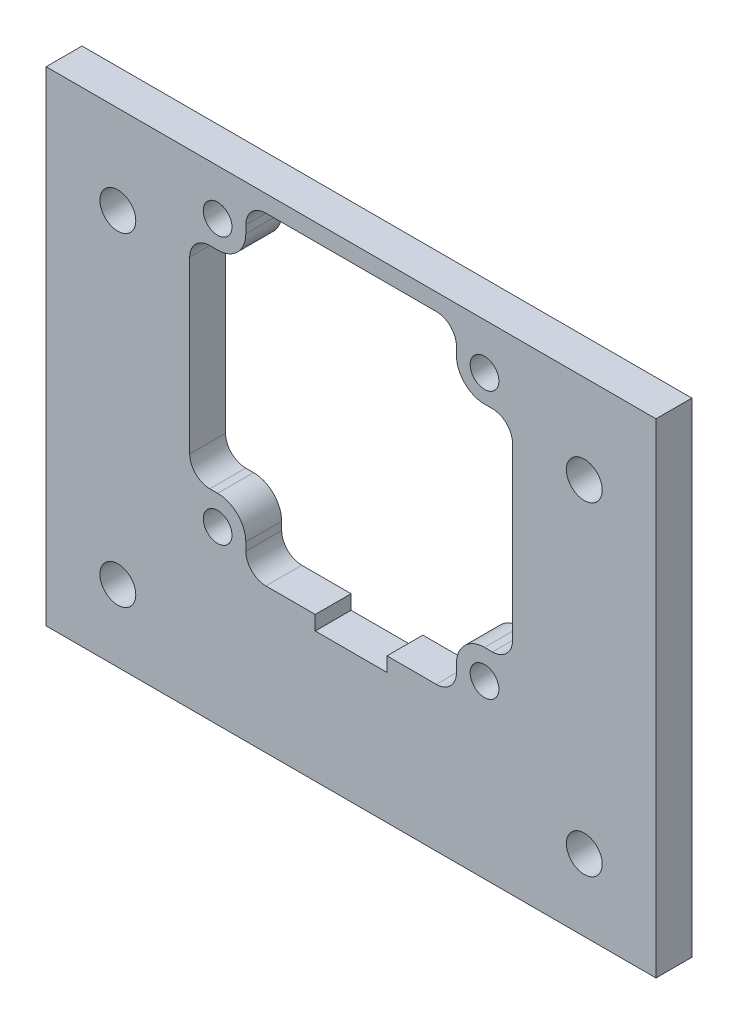
from build123d import *

# Parameters (mm, degrees)
SKETCH1_W           = 107.95
SKETCH1_H           = 85.725
BOSS_EXTRUDE1_DEPTH = 6.35
SKETCH11_R          = 2.54
CUT_EXTRUDE2_DEPTH  = 7.62
CUT_EXTRUDE3_DEPTH  = 7.62
SKETCH13_R          = 3.175
CUT_EXTRUDE4_DEPTH  = 7.62


with BuildPart() as part:
    # Sketch1 → Boss-Extrude1 (new body)
    with BuildSketch(Plane.XY):
        with Locations((0, -11.1125)):
            Rectangle(SKETCH1_W, SKETCH1_H)
    extrude(amount=BOSS_EXTRUDE1_DEPTH)

    # Sketch11 → Cut-Extrude2 (cut)
    with BuildSketch(Plane(origin=(0, 0, 0), x_dir=(-1, 0, 0), z_dir=(0, 0, -1))):
        with Locations((23.622, -23.622)):
            Circle(SKETCH11_R)
        with Locations((-23.622, -23.622)):
            Circle(SKETCH11_R)
        with Locations((-23.622, 23.622)):
            Circle(SKETCH11_R)
        with Locations((23.622, 23.622)):
            Circle(SKETCH11_R)
    extrude(amount=-CUT_EXTRUDE2_DEPTH, mode=Mode.SUBTRACT)

    # Sketch12 → Cut-Extrude3 (cut)
    with BuildSketch(Plane(origin=(0, 0, 0), x_dir=(-1, 0, 0), z_dir=(0, 0, -1))):
        with BuildLine():
            Line((-23.630545804, 18.82097215), (-25.027545804, 18.82097215))
            ThreePointArc((-25.027545804, 18.82097215), (-27.542017518, 17.779443863), (-28.583545804, 15.26497215))
            Line((-28.583545804, 15.26497215), (-28.583545804, -14.91022785))
            ThreePointArc((-28.583545804, -14.91022785), (-27.542017518, -17.424699564), (-25.027545804, -18.46622785))
            Line((-25.027545804, -18.46622785), (-23.630545804, -18.46622785))
            ThreePointArc((-23.630545804, -18.46622785), (-20.110285404, -19.924367451), (-18.652145804, -23.44462785))
            Line((-18.652145804, -23.44462785), (-18.652145804, -24.84162785))
            ThreePointArc((-18.652145804, -24.84162785), (-17.610617518, -27.356099564), (-15.096145804, -28.39762785))
            Line((-15.096145804, -28.39762785), (-6.358545804, -28.39762785))
            Line((-6.358545804, -28.39762785), (-6.358545804, -30.93762785))
            Line((-6.358545804, -30.93762785), (6.341454196, -30.93762785))
            Line((6.341454196, -30.93762785), (6.341454196, -28.39762785))
            Line((6.341454196, -28.39762785), (15.079054196, -28.39762785))
            ThreePointArc((15.079054196, -28.39762785), (17.59352591, -27.356099564), (18.635054196, -24.84162785))
            Line((18.635054196, -24.84162785), (18.635054196, -23.44462785))
            ThreePointArc((18.635054196, -23.44462785), (20.093193797, -19.924367451), (23.613454196, -18.46622785))
            Line((23.613454196, -18.46622785), (25.010454196, -18.46622785))
            ThreePointArc((25.010454196, -18.46622785), (27.52492591, -17.424699564), (28.566454196, -14.91022785))
            Line((28.566454196, -14.91022785), (28.566454196, 15.26497215))
            ThreePointArc((28.566454196, 15.26497215), (27.52492591, 17.779443863), (25.010454196, 18.82097215))
            Line((25.010454196, 18.82097215), (23.613454196, 18.82097215))
            ThreePointArc((23.613454196, 18.82097215), (20.093193797, 20.27911175), (18.635054196, 23.79937215))
            Line((18.635054196, 23.79937215), (18.635054196, 25.19637215))
            ThreePointArc((18.635054196, 25.19637215), (17.59352591, 27.710843863), (15.079054196, 28.75237215))
            Line((15.079054196, 28.75237215), (-15.096145804, 28.75237215))
            ThreePointArc((-15.096145804, 28.75237215), (-17.610617518, 27.710843863), (-18.652145804, 25.19637215))
            Line((-18.652145804, 25.19637215), (-18.652145804, 23.79937215))
            ThreePointArc((-18.652145804, 23.79937215), (-20.110285404, 20.27911175), (-23.630545804, 18.82097215))
        make_face()
    extrude(amount=-CUT_EXTRUDE3_DEPTH, mode=Mode.SUBTRACT)

    # Sketch13 → Cut-Extrude4 (cut)
    with BuildSketch(Plane(origin=(0, 0, 0), x_dir=(-1, 0, 0), z_dir=(0, 0, -1))):
        with Locations((-41.283545804, 16.05237215)):
            Circle(SKETCH13_R)
        with Locations((-41.283545804, -41.275)):
            Circle(SKETCH13_R)
        with Locations((41.283545804, -41.275)):
            Circle(SKETCH13_R)
        with Locations((41.283545804, 16.05237215)):
            Circle(SKETCH13_R)
    extrude(amount=-CUT_EXTRUDE4_DEPTH, mode=Mode.SUBTRACT)


solid = part.part
